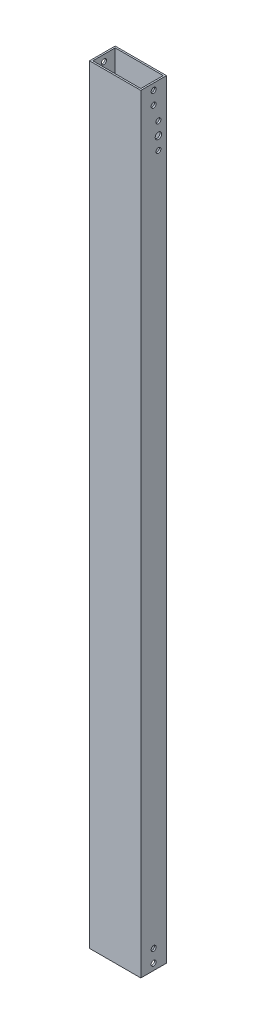
from build123d import *

# Parameters (mm, degrees)
SKETCH1_W               = 50.8
SKETCH1_H               = 762
BOSS_EXTRUDE1_DEPTH     = 12.7
SHELL1_T                = -1.5875
SKETCH3_R               = 2.4892
CUT_EXTRUDE1_DEPTH      = 383.056867495
CUT_EXTRUDE2_DEPTH      = 383.056867495
CUT_EXTRUDE2_DEPTH_BACK = 383.056867495
SKETCH4_R               = 3.175
SKETCH4_R_2             = 2.4892
SKETCH5_W               = 31.75
SKETCH5_H               = 26.9875
CUT_EXTRUDE3_DEPTH      = 383.056867495
FILLET1_R               = 3.175


with BuildPart() as part:
    # Sketch1 → Boss-Extrude1 (new, symmetric)
    with BuildSketch(Plane.XY):
        Rectangle(SKETCH1_W, SKETCH1_H)
    extrude(amount=BOSS_EXTRUDE1_DEPTH, both=True)

    # Shell1
    shell1_openings = [part.faces().sort_by_distance(p)[0] for p in [
        (0, -381, 0),
        (0, 381, 0),
    ]]
    offset(amount=SHELL1_T, openings=shell1_openings, kind=Kind.INTERSECTION)

    # Sketch3 → Cut-Extrude1 (cut, symmetric)
    with BuildSketch(Plane(origin=(0, 0, 0), x_dir=(0, 0, -1), z_dir=(1, 0, 0))):
        with Locations((0, -374.65)):
            Circle(SKETCH3_R)
        with Locations((0, -361.95)):
            Circle(SKETCH3_R)
    cut_extrude1 = extrude(amount=CUT_EXTRUDE1_DEPTH, both=True, mode=Mode.SUBTRACT)

    # Sketch4 → Cut-Extrude2 (cut, two sides: drawn at the far end of the back side and taken through both)
    with BuildSketch(Plane(origin=(0, 0, 0), x_dir=(0, 0, -1), z_dir=(1, 0, 0)).offset(-CUT_EXTRUDE2_DEPTH_BACK)):
        with Locations((4.7625, 333.375)):
            Circle(SKETCH4_R)
        with Locations((4.7625, 346.075)):
            Circle(SKETCH4_R_2)
        with Locations((4.7625, 320.675)):
            Circle(SKETCH4_R_2)
    extrude(amount=CUT_EXTRUDE2_DEPTH + CUT_EXTRUDE2_DEPTH_BACK, mode=Mode.SUBTRACT)

    # Mirror1: Cut-Extrude1 across plane
    add(cut_extrude1.mirror(Plane.ZX), mode=Mode.SUBTRACT)

    # Sketch5 → Cut-Extrude3 (cut, through all)
    with BuildSketch(Plane.XY):
        with Locations((0, 333.375)):
            Rectangle(SKETCH5_W, SKETCH5_H)
    extrude(amount=-CUT_EXTRUDE3_DEPTH, mode=Mode.SUBTRACT)

    # Fillet1
    fillet1_edges = [part.edges().sort_by_distance(p)[0] for p in [
        (15.875, 346.86875, -11.90625),
        (15.875, 319.88125, -11.90625),
        (-15.875, 319.88125, -11.90625),
        (-15.875, 346.86875, -11.90625),
    ]]
    fillet(fillet1_edges, radius=FILLET1_R)


solid = part.part
